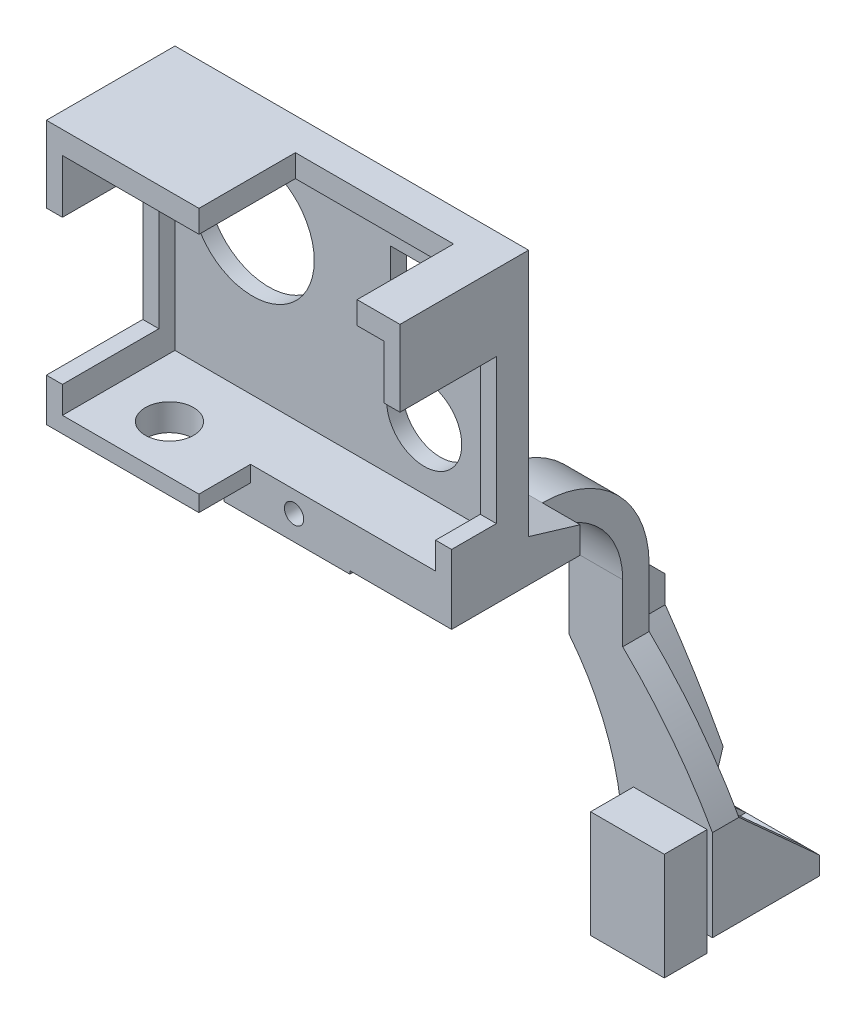
from build123d import *

# Parameters (mm, degrees)
RESSALTO_EXTRUS_O1_DEPTH              = 4.93
RESSALTO_EXTRUS_O2_DEPTH              = 14.7
RESSALTO_EXTRUS_O3_DEPTH              = 10
ESBO_O5_W                             = 16.75
ESBO_O5_H                             = 41.67
RESSALTO_EXTRUS_O4_DEPTH              = 4.93
CORTE_EXTRUS_O1_REACH                 = 85.706
RESSALTO_EXTRUS_O5_DEPTH              = 16.75
RESSALTO_EXTRUS_O6_DEPTH              = 19
CORTE_EXTRUS_O2_REACH                 = 96.288
ESBO_O9_W                             = 10.75
ESBO_O9_H                             = 13.64
CORTE_EXTRUS_O3_REACH                 = 96.288
ESBO_O10_W                            = 13
ESBO_O10_H                            = 15.64
ESBO_O11_W                            = 13.75
ESBO_O11_H                            = 8
RESSALTO_EXTRUS_O7_DEPTH              = 20
ESBO_O12_W                            = 6
ESBO_O12_H                            = 39.4
RESSALTO_EXTRUS_O8_DEPTH              = 5
RESSALTO_EXTRUS_O9_DEPTH              = 5
CHANFRO1_SIZE                         = 5
CHANFRO2_SIZE                         = 5
CORTE_EXTRUS_O4_REACH                 = 95.911
ESBO_O14_R                            = 1.6
ESBO_O15_W                            = 19
ESBO_O15_H                            = 24
RESSALTO_EXTRUS_O10_DEPTH             = 3
RESSALTO_EXTRUS_O10_DIRECTION_2_REACH = 100.49
RESSALTO_EXTRUS_O11_DEPTH             = 46.2
RESSALTO_EXTRUS_O11_DEPTH_BACK        = 3
ESBO_O16_W                            = 66
ESBO_O16_H                            = 3
RESSALTO_EXTRUS_O12_DEPTH             = 21
ESBO_O18_W                            = 29.52
ESBO_O18_H                            = 4.2
ESBO_O18_W_2                          = 3
ESBO_O18_H_2                          = 32
ESBO_O18_W_3                          = 18.53
ESBO_O18_H_3                          = 3
ESBO_O18_H_4                          = 27
RESSALTO_EXTRUS_O13_DEPTH             = 3
CORTE_EXTRUS_O5_REACH                 = 101.229
ESBO_O19_R                            = 11.5
ESBO_O19_R_2                          = 7
ESBO_O19_W                            = 11.5
ESBO_O19_H                            = 8
CHANFRO3_SIZE                         = 3
CHANFRO3_SIZE_2                       = 10
CORTE_EXTRUS_O6_REACH                 = 117.287
ESBO_O20_R                            = 4.5
RESSALTO_EXTRUS_O14_START             = 2
ESBO_O21_R                            = 6.5
ESBO_O21_R_2                          = 4.5
RESSALTO_EXTRUS_O14_DEPTH             = 2
ESBO_O24_W                            = 3
ESBO_O24_H                            = 5
RESSALTO_EXTRUS_O15_DEPTH             = 8.36
ESBO_O25_W                            = 8
ESBO_O25_H                            = 6
RESSALTO_EXTRUS_O16_DEPTH             = 5.5
ESBO_O26_R                            = 1.6
RESSALTO_EXTRUS_O17_DEPTH             = 3
ESBO_O28_W                            = 16.75
ESBO_O28_H                            = 3
CORTE_EXTRUS_O7_DEPTH                 = 20
ESBO_O29_W                            = 19
ESBO_O29_H                            = 2.999181093
CORTE_EXTRUS_O8_DEPTH                 = 20
ESBO_O30_W                            = 19
ESBO_O30_H                            = 72.430818907
CORTE_EXTRUS_O9_DEPTH                 = 106.156312221
RESSALTO_EXTRUS_O18_REACH             = 102.704
ESBO_O31_W                            = 23.524536133
ESBO_O31_H                            = 8.5
RESSALTO_EXTRUS_O18_DIRECTION_2_REACH = 102.704
ESBO_O32_R                            = 1.8
CORTE_EXTRUS_O10_DEPTH                = 10
CORTE_EXTRUS_O11_START                = -3
CORTE_EXTRUS_O11_DEPTH                = 2.9


# Some blends are built 0.0001 mm under size
with BuildPart() as part:
    # Esboço1 → Ressalto-extrusão1 (new body)
    with BuildSketch(Plane.XY):
        Polygon((0, 0), (-14.7, 0), (-14.7, -61.4), (4.3, -61.4), (4.3, -39.4), align=None)
    extrude(amount=RESSALTO_EXTRUS_O1_DEPTH)

    # Esboço2 → Ressalto-extrusão2 (add)
    with BuildSketch(Plane.ZY.offset(14.7)):
        with BuildLine():
            Line((0, 0), (4.93, 0))
            ThreePointArc((4.93, 0), (1.699387796, 7.799387796), (-6.1, 11.03))
            Line((-6.1, 11.03), (-30.1, 11.03))
            Line((-30.1, 11.03), (-30.1, 6.1))
            Line((-30.1, 6.1), (-6.1, 6.1))
            ThreePointArc((-6.1, 6.1), (-1.786648635, 4.313351365), (0, 0))
        make_face()
    extrude(amount=-RESSALTO_EXTRUS_O2_DEPTH)

    # Esboço4 → Ressalto-extrusão3 (add)
    with BuildSketch(Plane.ZY.offset(12.76)):
        with BuildLine():
            Line((-30.1, 11.03), (-30.1, 6.1))
            ThreePointArc((-30.1, 6.1), (-40.706601718, 1.706601718), (-45.1, -8.9))
            Line((-45.1, -8.9), (-45.1, -61.4))
            Line((-45.1, -61.4), (-50.03, -61.4))
            Line((-50.03, -61.4), (-50.03, -8.9))
            ThreePointArc((-50.03, -8.9), (-44.192638149, 5.192638149), (-30.1, 11.03))
        make_face()
    extrude(amount=-RESSALTO_EXTRUS_O3_DEPTH)

    # Esboço5 → Ressalto-extrusão4 (add)
    with BuildSketch(Plane(origin=(0, 0, -50.03), x_dir=(-1, 0, 0), z_dir=(0, 0, -1))):
        with Locations((-5.615, -40.565)):
            Rectangle(ESBO_O5_W, ESBO_O5_H)
    extrude(amount=-RESSALTO_EXTRUS_O4_DEPTH)

    # Esboço6 → Corte-extrusão1 (cut, up to next)
    with BuildSketch(Plane(origin=(0, 0, -50.03), x_dir=(-1, 0, 0), z_dir=(0, 0, -1)), mode=Mode.PRIVATE) as corte_extrus_o1_sk1:
        with BuildLine():
            Line((12.76, -61.4), (2.76, -61.4))
            Line((2.76, -61.4), (2.76, -51.4))
            ThreePointArc((2.76, -51.4), (5.321457267, -36.21444446), (12.76, -22.73))
            Line((12.76, -22.73), (12.76, -61.4))
        make_face()
    corte_extrus_o1_tool1 = extrude(corte_extrus_o1_sk1.sketch, amount=-CORTE_EXTRUS_O1_REACH, mode=Mode.PRIVATE) & part.part
    # Esboço6 → Corte-extrusão1 (cut, up to next)
    with BuildSketch(Plane(origin=(0, 0, -50.03), x_dir=(-1, 0, 0), z_dir=(0, 0, -1)), mode=Mode.PRIVATE) as corte_extrus_o1_sk2:
        with BuildLine():
            Line((-13.99, -41.4), (-13.99, -19.73))
            Line((-13.99, -19.73), (2.76, -19.73))
            ThreePointArc((2.76, -19.73), (-6.396882999, -29.960637276), (-13.99, -41.4))
        make_face()
    corte_extrus_o1_tool2 = extrude(corte_extrus_o1_sk2.sketch, amount=-CORTE_EXTRUS_O1_REACH, mode=Mode.PRIVATE) & part.part
    add(corte_extrus_o1_tool1.solids().sort_by_distance((-8.393606, -45.852679, -50.03))[0], mode=Mode.SUBTRACT)
    add(corte_extrus_o1_tool2.solids().sort_by_distance((8.680645, -26.580869, -50.03))[0], mode=Mode.SUBTRACT)

    # Esboço7 → Ressalto-extrusão5 (add)
    with BuildSketch(Plane.ZY.offset(2.76)):
        Polygon((-50.03, -61.4), (-65.1, -61.4), (-65.1, -55.04), (-50.03, -41.4), align=None)
    extrude(amount=-RESSALTO_EXTRUS_O5_DEPTH)

    # Esboço8 → Ressalto-extrusão6 (add)
    with BuildSketch(Plane.ZY.offset(14.7)):
        Polygon((4.93, -61.4), (20, -61.4), (20, -55.04), (4.93, -39.4), align=None)
    extrude(amount=-RESSALTO_EXTRUS_O6_DEPTH)

    # Esboço9 → Corte-extrusão2 (cut, up to next)
    with BuildSketch(Plane(origin=(0, 0, -50.03), x_dir=(-1, 0, 0), z_dir=(0, 0, -1)), mode=Mode.PRIVATE) as corte_extrus_o2_sk1:
        with Locations((-5.615, -48.22)):
            Rectangle(ESBO_O9_W, ESBO_O9_H)
    corte_extrus_o2_tool1 = extrude(corte_extrus_o2_sk1.sketch, amount=CORTE_EXTRUS_O2_REACH, mode=Mode.PRIVATE) & part.part
    add(corte_extrus_o2_tool1.solids().sort_by_distance((5.615, -48.22, -50.03))[0], mode=Mode.SUBTRACT)

    # Esboço10 → Corte-extrusão3 (cut, up to next)
    with BuildSketch(Plane.XY.offset(4.93), mode=Mode.PRIVATE) as corte_extrus_o3_sk1:
        with Locations((-5.2, -47.22)):
            Rectangle(ESBO_O10_W, ESBO_O10_H)
    corte_extrus_o3_tool1 = extrude(corte_extrus_o3_sk1.sketch, amount=CORTE_EXTRUS_O3_REACH, mode=Mode.PRIVATE) & part.part
    add(corte_extrus_o3_tool1.solids().sort_by_distance((-5.2, -47.22, 4.93))[0], mode=Mode.SUBTRACT)

    # Esboço11 → Ressalto-extrusão7 (add)
    with BuildSketch(Plane.XZ.offset(61.4)):
        with Locations((6.115, -41.1)):
            Rectangle(ESBO_O11_W, ESBO_O11_H)
    extrude(amount=-RESSALTO_EXTRUS_O7_DEPTH)

    # Esboço12 → Ressalto-extrusão8 (add)
    with BuildSketch(Plane.XY.offset(4.93)):
        with Locations((-7.35, -19.7)):
            Rectangle(ESBO_O12_W, ESBO_O12_H)
    extrude(amount=RESSALTO_EXTRUS_O8_DEPTH)

    # Esboço13 → Ressalto-extrusão9 (add)
    with BuildSketch(Plane(origin=(0, 0, -50.03), x_dir=(-1, 0, 0), z_dir=(0, 0, -1))):
        with BuildLine():
            Line((10.76, -8.9), (4.76, -8.9))
            Line((4.76, -8.9), (4.76, -18.9))
            ThreePointArc((4.76, -18.9), (-2.365001835, -29.889929465), (-8.615, -41.4))
            Line((-8.615, -41.4), (-2.615, -41.4))
            ThreePointArc((-2.615, -41.4), (3.649096622, -30.303670043), (10.76, -19.73))
            Line((10.76, -19.73), (10.76, -8.9))
        make_face()
    extrude(amount=RESSALTO_EXTRUS_O9_DEPTH)

    # Chanfro1
    chanfro1_edges = [part.edges().sort_by_distance(p)[0] for p in [
        (-7.76, -8.9, -55.03),
        (5.615, -41.4, -55.03),
    ]]
    chamfer(chanfro1_edges, length=CHANFRO1_SIZE - 0.0001)  # a hair under: the kernel refuses the full size

    # Chanfro2
    chanfro2_edges = [part.edges().sort_by_distance(p)[0] for p in [
        (-7.35, -39.4, 9.93),
        (-7.35, 0, 9.93),
    ]]
    chamfer(chanfro2_edges, length=CHANFRO2_SIZE - 0.0001)  # a hair under: the kernel refuses the full size

    # Esboço14 → Corte-extrusão4 (cut, up to next)
    with BuildSketch(Plane(origin=(0, -55.04, 0), x_dir=(1, 0, 0), z_dir=(0, 1, 0)), mode=Mode.PRIVATE) as corte_extrus_o4_sk1:
        with Locations(Location((-5.2, -12.465, 0), (0, 0, 270))):
            Circle(ESBO_O14_R)
    corte_extrus_o4_tool1 = extrude(corte_extrus_o4_sk1.sketch, amount=-CORTE_EXTRUS_O4_REACH, mode=Mode.PRIVATE) & part.part
    # Esboço14 → Corte-extrusão4 (cut, up to next)
    with BuildSketch(Plane(origin=(0, -55.04, 0), x_dir=(1, 0, 0), z_dir=(0, 1, 0)), mode=Mode.PRIVATE) as corte_extrus_o4_sk2:
        with Locations(Location((5.615, 57.56, 0), (0, 0, 270))):
            Circle(ESBO_O14_R)
    corte_extrus_o4_tool2 = extrude(corte_extrus_o4_sk2.sketch, amount=-CORTE_EXTRUS_O4_REACH, mode=Mode.PRIVATE) & part.part
    add(corte_extrus_o4_tool1.solids().sort_by_distance((-5.2, -55.04, 12.465))[0], mode=Mode.SUBTRACT)
    add(corte_extrus_o4_tool2.solids().sort_by_distance((5.615, -55.04, -57.56))[0], mode=Mode.SUBTRACT)

    # Esboço15 → Ressalto-extrusão10 (add)
    with BuildSketch(Plane(origin=(0, 11.03, 0), x_dir=(1, 0, 0), z_dir=(0, 1, 0))):
        with Locations((-5.2, 18.1)):
            Rectangle(ESBO_O15_W, ESBO_O15_H)
    extrude(amount=RESSALTO_EXTRUS_O10_DEPTH)

    # Ressalto-extrusão10 direction 2: up to this face of the body (flat: up to its plane)
    ressalto_extrus_o10_direction_2_end = Plane(part.part.faces().sort_by_distance((-7.35, 6.1, -18.1))[0])
    # Esboço15 → Ressalto-extrusão10 direction 2 (add, up to the picked face)
    with BuildSketch(Plane(origin=(0, 11.03, 0), x_dir=(1, 0, 0), z_dir=(0, 1, 0)), mode=Mode.PRIVATE) as ressalto_extrus_o10_direction_2_sk1:
        with Locations((-5.2, 18.1)):
            Rectangle(ESBO_O15_W, ESBO_O15_H)
    ressalto_extrus_o10_direction_2_tool1 = split(extrude(ressalto_extrus_o10_direction_2_sk1.sketch, amount=-RESSALTO_EXTRUS_O10_DIRECTION_2_REACH, mode=Mode.PRIVATE), bisect_by=ressalto_extrus_o10_direction_2_end, keep=Keep.BOTH, mode=Mode.PRIVATE)
    add(ressalto_extrus_o10_direction_2_tool1.solids().sort_by(Axis((-5.2, 11.03, -18.1), (0, -1, 0)))[0])

    # Esboço16 → Ressalto-extrusão11 (add, two sides: drawn at the far end of the back side and taken through both)
    with BuildSketch(Plane(origin=(0, 14.03, 0), x_dir=(1, 0, 0), z_dir=(0, 1, 0)).offset(-RESSALTO_EXTRUS_O11_DEPTH_BACK)):
        with Locations((-28.7, 18.96)):
            Rectangle(ESBO_O16_W, ESBO_O16_H)
    extrude(amount=RESSALTO_EXTRUS_O11_DEPTH + RESSALTO_EXTRUS_O11_DEPTH_BACK)

    # Esboço17 → Ressalto-extrusão12 (add)
    with BuildSketch(Plane.XY.offset(-17.46)):
        Polygon((-61.7, 60.23), (-33.22, 60.23), (-33.22, 56.03), (-58.7, 56.03), (-58.7, 46.03), (-61.7, 46.03), align=None)
        Polygon((-61.7, 11.03), (-61.7, 19.03), (-58.7, 19.03), (-58.7, 14.03), (-33.23, 14.03), (-33.23, 11.03), align=None)
        Polygon((4.3, 60.23), (4.3, 46.03), (1.3, 46.03), (1.3, 56.03), (-3.7, 56.03), (-3.7, 60.23), align=None)
    extrude(amount=RESSALTO_EXTRUS_O12_DEPTH)

    # Esboço18 → Ressalto-extrusão13 (add)
    with BuildSketch(Plane.XY.offset(-17.46)):
        with Locations((-18.46, 58.13)):
            Rectangle(ESBO_O18_W, ESBO_O18_H)
        with Locations((2.8, 30.03)):
            Rectangle(ESBO_O18_W_2, ESBO_O18_H_2)
        with Locations((-23.965, 12.53)):
            Rectangle(ESBO_O18_W_3, ESBO_O18_H_3)
        with Locations((-60.2, 32.53)):
            Rectangle(ESBO_O18_W_2, ESBO_O18_H_4)
    extrude(amount=RESSALTO_EXTRUS_O13_DEPTH)

    # Esboço19 → Corte-extrusão5 (cut, up to next)
    with BuildSketch(Plane.XY.offset(-17.46), mode=Mode.PRIVATE) as corte_extrus_o5_sk1:
        with Locations((-44.2, 41.53)):
            Circle(ESBO_O19_R)
    corte_extrus_o5_tool1 = extrude(corte_extrus_o5_sk1.sketch, amount=-CORTE_EXTRUS_O5_REACH, mode=Mode.PRIVATE) & part.part
    # Esboço19 → Corte-extrusão5 (cut, up to next)
    with BuildSketch(Plane.XY.offset(-17.46), mode=Mode.PRIVATE) as corte_extrus_o5_sk2:
        with Locations((-12.17, 25.53)):
            Circle(ESBO_O19_R_2)
    corte_extrus_o5_tool2 = extrude(corte_extrus_o5_sk2.sketch, amount=-CORTE_EXTRUS_O5_REACH, mode=Mode.PRIVATE) & part.part
    # Esboço19 → Corte-extrusão5 (cut, up to next)
    with BuildSketch(Plane.XY.offset(-17.46), mode=Mode.PRIVATE) as corte_extrus_o5_sk3:
        with Locations((-12.72, 47.03)):
            Rectangle(ESBO_O19_W, ESBO_O19_H)
    corte_extrus_o5_tool3 = extrude(corte_extrus_o5_sk3.sketch, amount=-CORTE_EXTRUS_O5_REACH, mode=Mode.PRIVATE) & part.part
    add(corte_extrus_o5_tool1.solids().sort_by_distance((-44.2, 41.53, -17.46))[0], mode=Mode.SUBTRACT)
    add(corte_extrus_o5_tool2.solids().sort_by_distance((-12.17, 25.53, -17.46))[0], mode=Mode.SUBTRACT)
    add(corte_extrus_o5_tool3.solids().sort_by_distance((-12.72, 47.03, -17.46))[0], mode=Mode.SUBTRACT)

    # Chanfro3
    # the kernel refuses this chamfer: 10, 3 mm, written as the material it takes off along each edge
    with BuildSketch(Plane(origin=(30.259416678, 14.03, -30.1), x_dir=(0, -0.9925205348140391, -0.12207779475585895), z_dir=(-1, 0, 0))) as chanfro3_piece_1_section:
        Polygon((CHANFRO3_SIZE * 0.992520534814, CHANFRO3_SIZE * 0.122077794756), (-CHANFRO3_SIZE_2 * 0.122077794756, CHANFRO3_SIZE_2 * 0.992520534814), (0, 0), align=None)
    chanfro3_piece_1 = extrude(amount=70.918833356, mode=Mode.PRIVATE)
    chanfro3_piece_1 = split(chanfro3_piece_1, bisect_by=Plane(origin=(0.77, 13.028749035, -20.46), z_dir=(0, 0, -1)), keep=Keep.TOP, mode=Mode.PRIVATE)
    add(chanfro3_piece_1, mode=Mode.SUBTRACT)

    # Esboço20 → Corte-extrusão6 (cut, up to next)
    with BuildSketch(Plane.XZ.offset(-11.03), mode=Mode.PRIVATE) as corte_extrus_o6_sk1:
        with Locations(Location((-47.72, -5.46, 0), (0, 0, 270))):
            Circle(ESBO_O20_R)
    corte_extrus_o6_tool1 = extrude(corte_extrus_o6_sk1.sketch, amount=-CORTE_EXTRUS_O6_REACH, mode=Mode.PRIVATE) & part.part
    add(corte_extrus_o6_tool1.solids().sort_by_distance((-47.72, 11.03, -5.46))[0], mode=Mode.SUBTRACT)

    # Esboço21 → Ressalto-extrusão14 (add)
    with BuildSketch(Plane.XZ.offset(-11.03).offset(RESSALTO_EXTRUS_O14_START)):
        with Locations(Location((-47.72, -5.46, 0), (0, 0, 270))):
            Circle(ESBO_O21_R)
        with Locations(Location((-47.72, -5.46, 0), (0, 0, 270))):
            Circle(ESBO_O21_R_2, mode=Mode.SUBTRACT)
    extrude(amount=-RESSALTO_EXTRUS_O14_DEPTH)

    # Esboço24 → Ressalto-extrusão15 (add)
    with BuildSketch(Plane.XY.offset(-14.46)):
        with Locations((2.8, 16.53)):
            Rectangle(ESBO_O24_W, ESBO_O24_H)
    extrude(amount=RESSALTO_EXTRUS_O15_DEPTH)

    # Esboço25 → Ressalto-extrusão16 (add)
    with BuildSketch(Plane.XZ.offset(-11.03)):
        with Locations((-34.224536133, -17.46)):
            Rectangle(ESBO_O25_W, ESBO_O25_H)
    extrude(amount=RESSALTO_EXTRUS_O16_DEPTH)

    # Esboço26 → Ressalto-extrusão17 (add)
    with BuildSketch(Plane.ZY.offset(61.7)):
        Polygon((-12.788900808, 11.03), (-17.788769684, 5.527904968), (-26.876469574, 5.527904968), (-26.87626358, 13.272938232), (-20.46, 18.272442322), (-20.46, 11.03), align=None)
        with Locations((-22.27092052, 9.297904968)):
            Circle(ESBO_O26_R, mode=Mode.SUBTRACT)
    extrude(amount=-RESSALTO_EXTRUS_O17_DEPTH)

    # Esboço28 → Corte-extrusão7 (cut)
    with BuildSketch(Plane(origin=(0, 0, -65.1), x_dir=(-1, 0, 0), z_dir=(0, 0, -1))):
        with Locations((-5.615, -59.9)):
            Rectangle(ESBO_O28_W, ESBO_O28_H)
    extrude(amount=-CORTE_EXTRUS_O7_DEPTH, mode=Mode.SUBTRACT)

    # Esboço29 → Corte-extrusão8 (cut)
    with BuildSketch(Plane.XY.offset(20)):
        with Locations((-5.2, -59.900409454)):
            Rectangle(ESBO_O29_W, ESBO_O29_H)
    extrude(amount=-CORTE_EXTRUS_O8_DEPTH, mode=Mode.SUBTRACT)

    # Esboço30 → Corte-extrusão9 (cut, through all)
    with BuildSketch(Plane.XY.offset(-6.1)):
        with Locations((-5.2, -22.185409454)):
            Rectangle(ESBO_O30_W, ESBO_O30_H)
    extrude(amount=CORTE_EXTRUS_O9_DEPTH, mode=Mode.SUBTRACT)

    # Ressalto-extrusão18: up to this face of the body (flat: up to its plane)
    ressalto_extrus_o18_end = Plane(part.part.faces().sort_by_distance((-4.475668498, 10.650350395, -6.1))[0])
    # Esboço31 → Ressalto-extrusão18 (add, up to the picked face)
    with BuildSketch(Plane.XY.offset(-14.46), mode=Mode.PRIVATE) as ressalto_extrus_o18_sk1:
        with Locations((-26.462268067, 9.78)):
            Rectangle(ESBO_O31_W, ESBO_O31_H)
    ressalto_extrus_o18_tool1 = split(extrude(ressalto_extrus_o18_sk1.sketch, amount=RESSALTO_EXTRUS_O18_REACH, mode=Mode.PRIVATE), bisect_by=ressalto_extrus_o18_end, keep=Keep.BOTH, mode=Mode.PRIVATE)
    add(ressalto_extrus_o18_tool1.solids().sort_by(Axis((-26.462268, 9.78, -14.46), (0, 0, 1)))[0])

    # Ressalto-extrusão18 direction 2: up to this face of the body (flat: up to its plane)
    ressalto_extrus_o18_direction_2_end = Plane(part.part.faces().sort_by_distance((-28.083039106, 35.073559946, -20.46))[0])
    # Esboço31 → Ressalto-extrusão18 direction 2 (add, up to the picked face)
    with BuildSketch(Plane.XY.offset(-14.46), mode=Mode.PRIVATE) as ressalto_extrus_o18_direction_2_sk1:
        with Locations((-26.462268067, 9.78)):
            Rectangle(ESBO_O31_W, ESBO_O31_H)
    ressalto_extrus_o18_direction_2_tool1 = split(extrude(ressalto_extrus_o18_direction_2_sk1.sketch, amount=-RESSALTO_EXTRUS_O18_DIRECTION_2_REACH, mode=Mode.PRIVATE), bisect_by=ressalto_extrus_o18_direction_2_end, keep=Keep.BOTH, mode=Mode.PRIVATE)
    add(ressalto_extrus_o18_direction_2_tool1.solids().sort_by(Axis((-26.462268, 9.78, -14.46), (0, 0, -1)))[0])

    # Esboço32 → Corte-extrusão10 (cut)
    with BuildSketch(Plane.XY.offset(-6.1)):
        with Locations((-25.11, 10.100818907)):
            Circle(ESBO_O32_R)
    extrude(amount=-CORTE_EXTRUS_O10_DEPTH, mode=Mode.SUBTRACT)

    # Esboço33 → Corte-extrusão11 (cut)
    with BuildSketch(Plane.XY.offset(-6.1).offset(CORTE_EXTRUS_O11_START)):
        Polygon((-28.26, 8.282165559), (-28.26, 11.919472254), (-25.11, 13.738125602), (-21.96, 11.919472254), (-21.96, 8.282165559), (-21.96, 5.53), (-28.26, 5.53), align=None)
    extrude(amount=-CORTE_EXTRUS_O11_DEPTH, mode=Mode.SUBTRACT)


solid = part.part
